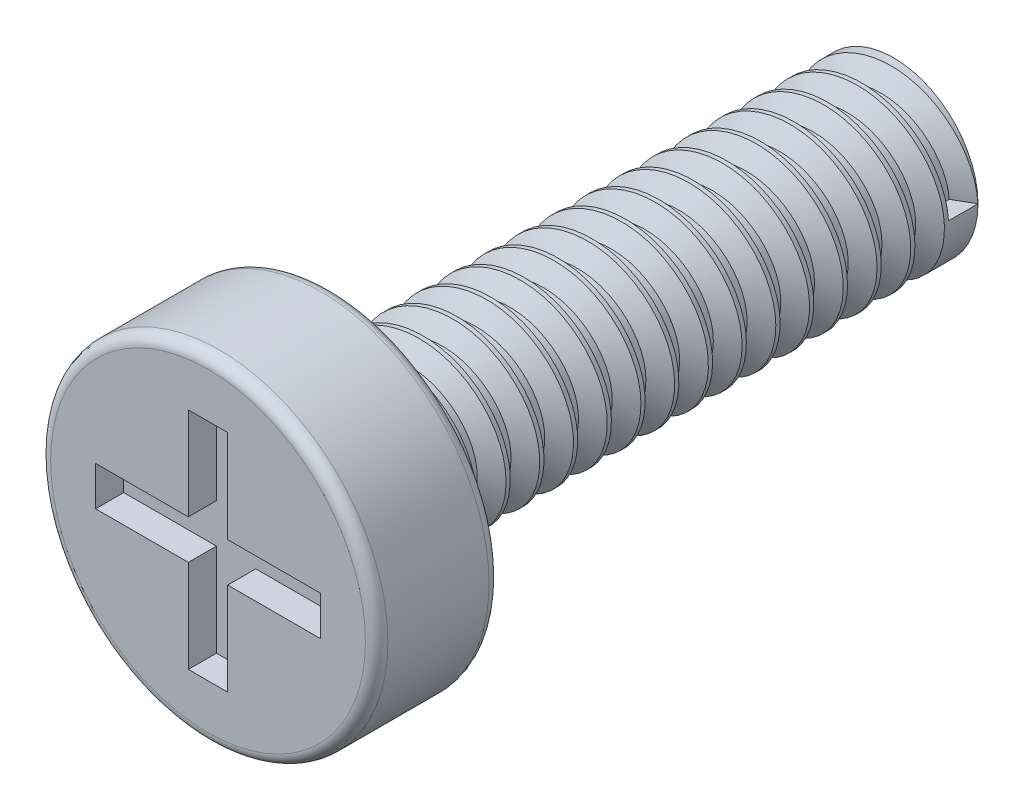
from build123d import *

# Parameters (mm, degrees)
SKETCH1_R           = 1.5
BOSS_EXTRUDE1_DEPTH = 10
SKETCH2_R           = 3
BOSS_EXTRUDE2_DEPTH = 2.2
SKETCH7_W           = 0.7
SKETCH7_H           = 1.65
SKETCH7_W_2         = 1.65
SKETCH7_H_2         = 0.7
CUT_EXTRUDE1_DEPTH  = 0.5
FILLET1_R           = 0.2
THREAD1_PITCH       = 0.6


with BuildPart() as part:
    # Sketch1 → Boss-Extrude1 (new body)
    with BuildSketch(Plane.XY):
        Circle(SKETCH1_R)
    extrude(amount=BOSS_EXTRUDE1_DEPTH)

    # Sketch2 → Boss-Extrude2 (add)
    with BuildSketch(Plane.XY.offset(10)):
        Circle(SKETCH2_R)
    extrude(amount=BOSS_EXTRUDE2_DEPTH)

    # Sketch7 → Cut-Extrude1 (cut)
    with BuildSketch(Plane.XY.offset(12.2)):
        with Locations((0, 1.175)):
            Rectangle(SKETCH7_W, SKETCH7_H)
        with Locations((1.175, 0)):
            Rectangle(SKETCH7_W_2, SKETCH7_H_2)
        with Locations((0, -1.175)):
            Rectangle(SKETCH7_W, SKETCH7_H)
        with Locations((-1.175, 0)):
            Rectangle(SKETCH7_W_2, SKETCH7_H_2)
        Rectangle(SKETCH7_W, SKETCH7_H_2)
    extrude(amount=-CUT_EXTRUDE1_DEPTH, mode=Mode.SUBTRACT)

    # Fillet1
    fillet1_edges = [part.edges().sort_by_distance(p)[0] for p in [
        (-3, 0, 10),
        (-3, 0, 12.2),
    ]]
    fillet(fillet1_edges, radius=FILLET1_R)

    # Thread1: the profile of Thread Profile1 profile screwed along a right-hand helix of 16.666667 turns, 6 arcs to a turn; built about Z, then put on its axis
    thread1_z = Axis((0, 0, 0), (0, 0, 1))
    thread1_corners = [(1.5003, 0, -0.000173205), (1.5003, 0, 0.525173203), (1.175240475, 0, 0.337499999), (1.175240475, 0, 0.187499999)]
    with BuildLine(mode=Mode.PRIVATE) as thread1_profile:
        Line(thread1_corners[0], thread1_corners[1])
        Line(thread1_corners[1], thread1_corners[2])
        Line(thread1_corners[2], thread1_corners[3])
        Line(thread1_corners[3], thread1_corners[0])
    thread1_cap = Face(thread1_profile.wire())
    thread1_turn_angles = [0, 30, 60, 90, 120, 150, 180, 210, 240, 270, 300, 330, 360]
    thread1_turn_weights = [1, 0.8660254037844387, 1, 0.8660254037844387, 1, 0.8660254037844387, 1, 0.8660254037844387, 1, 0.8660254037844387, 1, 0.8660254037844387, 1]
    thread1_turn_rails = [Edge.make_bspline([Vector(p[0], p[1], 0).rotate(thread1_z, thread1_turn_angles[k]) / thread1_turn_weights[k] + Vector(0, 0, p[2] + THREAD1_PITCH * thread1_turn_angles[k] / 360) for k in range(13)], [0, 0, 0, 1, 1, 2, 2, 3, 3, 4, 4, 5, 5, 6, 6, 6], 2, thread1_turn_weights) for p in thread1_corners]
    thread1_turn_sides = [Face.make_surface_from_curves(thread1_turn_rails[p[0]], thread1_turn_rails[p[1]]) for p in [(0, 1), (1, 2), (2, 3), (3, 0)]]
    thread1_last_angles = [5760, 5790, 5820, 5850, 5880, 5910, 5940, 5970, 6000]
    thread1_last_weights = [1, 0.8660254037844387, 1, 0.8660254037844387, 1, 0.8660254037844387, 1, 0.8660254037844387, 1]
    thread1_last_rails = [Edge.make_bspline([Vector(p[0], p[1], 0).rotate(thread1_z, thread1_last_angles[k]) / thread1_last_weights[k] + Vector(0, 0, p[2] + THREAD1_PITCH * thread1_last_angles[k] / 360) for k in range(9)], [0, 0, 0, 1, 1, 2, 2, 3, 3, 4, 4, 4], 2, thread1_last_weights) for p in thread1_corners]
    thread1_last_sides = [Face.make_surface_from_curves(thread1_last_rails[p[0]], thread1_last_rails[p[1]]) for p in [(0, 1), (1, 2), (2, 3), (3, 0)]]
    thread1 = Plane(origin=(0, 0, 0), x_dir=(1, 0, 0), z_dir=(0, 0, 1)) * Solid(Shell([*[p.moved(Location((0, 0, THREAD1_PITCH * i))) for i in range(16) for p in thread1_turn_sides], *thread1_last_sides, thread1_cap, thread1_cap.rotate(thread1_z, 6000).moved(Location((0, 0, THREAD1_PITCH * 6000 / 360)))]))
    add(thread1, mode=Mode.SUBTRACT)


solid = part.part
